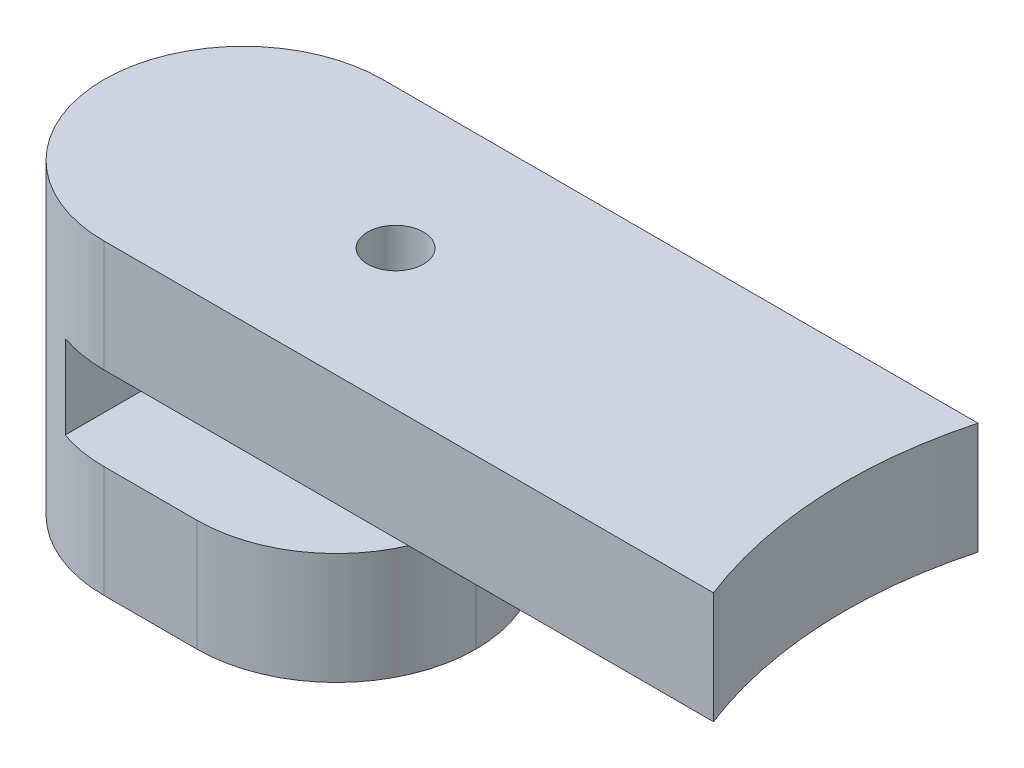
from build123d import *

# Parameters (mm, degrees)
SKETCH1_W           = 18.396209947
SKETCH1_H           = 7.5
BOSS_EXTRUDE1_DEPTH = 3
SKETCH3_W           = 7.837448939
SKETCH3_H           = 7.5
BOSS_EXTRUDE2_DEPTH = 3
SKETCH4_R           = 12
CUT_EXTRUDE2_DEPTH  = 3
SKETCH6_W           = 2.5
SKETCH6_H           = 7.5
BOSS_EXTRUDE3_DEPTH = 5.25
SKETCH7_W           = 7.5
SKETCH7_H           = 3
BOSS_EXTRUDE4_DEPTH = 7.5
CUT_EXTRUDE1_REACH  = 17.271
SKETCH2_R           = 0.75
FILLET1_R           = 3.75


with BuildPart() as part:
    # Sketch1 → Boss-Extrude1 (new body)
    with BuildSketch(Plane(origin=(0, 0, 0), x_dir=(1, 0, 0), z_dir=(0, 1, 0))):
        with Locations((9.198104974, 0)):
            Rectangle(SKETCH1_W, SKETCH1_H)
    extrude(amount=BOSS_EXTRUDE1_DEPTH)

    # Sketch3 → Boss-Extrude2 (add)
    with BuildSketch(Plane(origin=(0, 3, 0), x_dir=(1, 0, 0), z_dir=(0, 1, 0))):
        with Locations((-3.91872447, 0)):
            Rectangle(SKETCH3_W, SKETCH3_H)
    extrude(amount=-BOSS_EXTRUDE2_DEPTH)

    # Sketch4 → Cut-Extrude2 (cut)
    with BuildSketch(Plane(origin=(0, 3, 0), x_dir=(1, 0, 0), z_dir=(0, 1, 0))):
        with Locations((23.476391496, 0.596984019)):
            Circle(SKETCH4_R)
    extrude(amount=-CUT_EXTRUDE2_DEPTH, mode=Mode.SUBTRACT)

    # Sketch6 → Boss-Extrude3 (add)
    with BuildSketch(Plane.XZ):
        with Locations((-6.587448939, 0)):
            Rectangle(SKETCH6_W, SKETCH6_H)
    extrude(amount=BOSS_EXTRUDE3_DEPTH)

    # Sketch7 → Boss-Extrude4 (add)
    with BuildSketch(Plane(origin=(-5.337448939, 0, 0), x_dir=(0, 0, -1), z_dir=(1, 0, 0))):
        with Locations((0, -3.75)):
            Rectangle(SKETCH7_W, SKETCH7_H)
    extrude(amount=BOSS_EXTRUDE4_DEPTH)

    # Cut-Extrude1: up to this face of the body (flat: up to its plane)
    cut_extrude1_end = Plane(part.part.faces().sort_by_distance((-2.837448939, -5.25, 0))[0])
    # Sketch2 → Cut-Extrude1 (cut, up to the picked face)
    with BuildSketch(Plane(origin=(0, 3, 0), x_dir=(1, 0, 0), z_dir=(0, 1, 0)), mode=Mode.PRIVATE) as cut_extrude1_sk1:
        with Locations(Location((0, 0, 0), (0, 0, 90))):
            Circle(SKETCH2_R)
    cut_extrude1_tool1 = split(extrude(cut_extrude1_sk1.sketch, amount=-CUT_EXTRUDE1_REACH, mode=Mode.PRIVATE), bisect_by=cut_extrude1_end, keep=Keep.BOTH, mode=Mode.PRIVATE)
    add(cut_extrude1_tool1.solids().sort_by(Axis((0, 3, 0), (0, -1, 0)))[0], mode=Mode.SUBTRACT)

    # Fillet1
    # the kernel refuses this fillet: 3.75 mm, written as the material it takes off along each edge
    with BuildSketch(Plane(origin=(2.162551061, -14.625, -3.75), x_dir=(0, 0, 1), z_dir=(0, 1, 0))) as fillet1_piece_1:
        with BuildLine():
            CenterArc((FILLET1_R, -FILLET1_R), FILLET1_R, 90, 90)
            Line((0, -FILLET1_R), (0, 0))
            Line((0, 0), (FILLET1_R, 0))
        make_face()
    extrude(amount=12.375, mode=Mode.SUBTRACT)
    with BuildSketch(Plane(origin=(2.162551061, -2.25, 3.75), x_dir=(-1, 0, 0), z_dir=(0, -1, 0))) as fillet1_piece_2:
        with BuildLine():
            CenterArc((FILLET1_R, FILLET1_R), FILLET1_R, 180, 90)
            Line((0, FILLET1_R), (0, 0))
            Line((0, 0), (FILLET1_R, 0))
        make_face()
    extrude(amount=12.375, mode=Mode.SUBTRACT)
    with BuildSketch(Plane(origin=(-7.837448939, 12.375, 3.75), x_dir=(1, 0, 0), z_dir=(0, -1, 0)), Plane(origin=(-7.837448939, 12.375, -3.75), x_dir=(0, 0, 1), z_dir=(0, -1, 0))) as fillet1_piece_3:
        with BuildLine():
            CenterArc((FILLET1_R, -FILLET1_R), FILLET1_R, 90, 90)
            Line((0, -FILLET1_R), (0, 0))
            Line((0, 0), (FILLET1_R, 0))
        make_face()
    extrude(amount=27, mode=Mode.SUBTRACT)


solid = part.part
